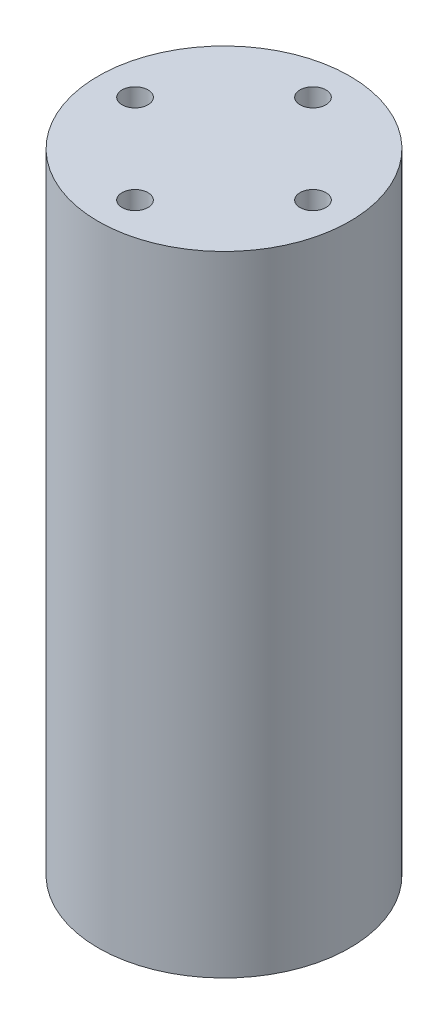
from build123d import *

# Parameters (mm, degrees)
SKETCH1_R           = 16
SKETCH1_R_2         = 1.65
BOSS_EXTRUDE1_DEPTH = 80


with BuildPart() as part:
    # Sketch1 → Boss-Extrude1 (new body)
    with BuildSketch(Plane(origin=(0, 0, 0), x_dir=(1, 0, 0), z_dir=(0, 1, 0))):
        Circle(SKETCH1_R)
        with Locations((0, 11.313708499)):
            Circle(SKETCH1_R_2, mode=Mode.SUBTRACT)
        with Locations((-11.313708499, 0)):
            Circle(SKETCH1_R_2, mode=Mode.SUBTRACT)
        with Locations((0, -11.313708499)):
            Circle(SKETCH1_R_2, mode=Mode.SUBTRACT)
        with Locations((11.313708499, 0)):
            Circle(SKETCH1_R_2, mode=Mode.SUBTRACT)
    extrude(amount=BOSS_EXTRUDE1_DEPTH)


solid = part.part
